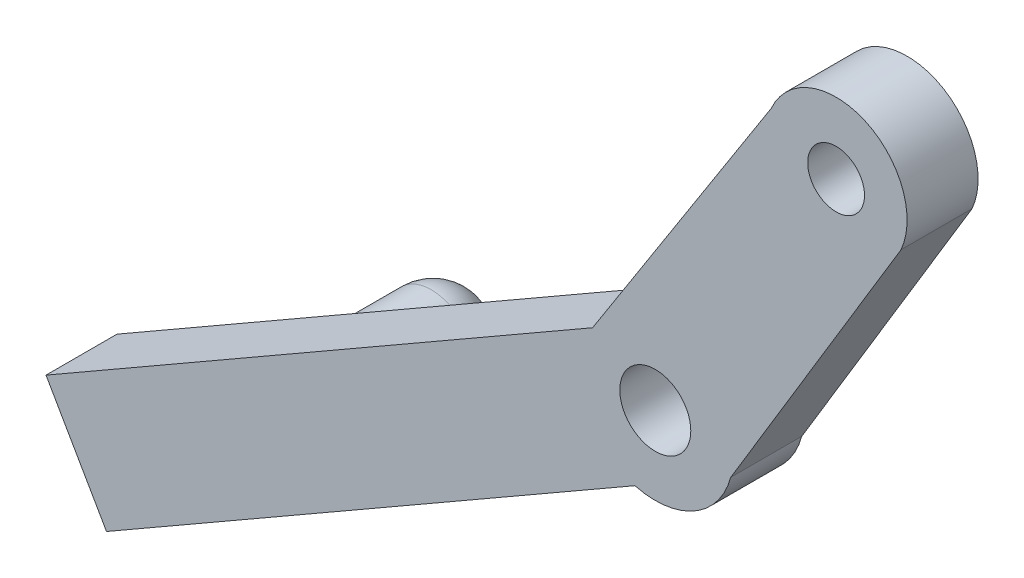
from build123d import *

# Parameters (mm, degrees)
SKETCH1_R           = 2
SKETCH1_R_2         = 2.5
BOSS_EXTRUDE1_DEPTH = 5
SKETCH8_R           = 3
BOSS_EXTRUDE3_DEPTH = 10


with BuildPart() as part:
    # Sketch1 → Boss-Extrude1 (new body)
    with BuildSketch(Plane(origin=(0, 0, 0), x_dir=(0.4985289035363021, -0.866873077410351, 0), z_dir=(0, 0, 1))):
        with BuildLine():
            ThreePointArc((8.899126574, -3.909046337), (10.510039278, -0.019959041), (8.899126574, 3.869128256))
            Line((8.899126574, 3.869128256), (-2.35642803, 24.179978159))
            ThreePointArc((-2.35642803, 24.179978159), (-9.345167797, 25.255857552), (-10.421047189, 18.267117784))
            Line((-10.421047189, 18.267117784), (0.353553391, -2.434608777))
            Line((0.353553391, -2.434608777), (0.353553391, -46.838046337))
            Line((0.353553391, -46.838046337), (8.899126574, -46.838046337))
            Line((8.899126574, -46.838046337), (8.899126574, -3.909046337))
        make_face()
        with Locations((-6.38873761, 21.223547972)):
            Circle(SKETCH1_R, mode=Mode.SUBTRACT)
        with Locations((5.010039278, -0.019959041)):
            Circle(SKETCH1_R_2, mode=Mode.SUBTRACT)
    extrude(amount=BOSS_EXTRUDE1_DEPTH)

    # Sketch8 → Boss-Extrude3 (add)
    with BuildSketch(Plane(origin=(0, 0, 0), x_dir=(-1, 0, 0), z_dir=(0, 0, -1))):
        with Locations((25.293181008, -19.882635909)):
            Circle(SKETCH8_R)
    extrude(amount=BOSS_EXTRUDE3_DEPTH)

    # Sketch9 → Cut-Revolve1 (revolve, cut)
    with BuildSketch(Plane(origin=(2.306364199, -4.010449578, 0), x_dir=(-0.8668730774103511, -0.498528903536302, 0), z_dir=(0.498528903536302, -0.8668730774103511, 0))):
        with BuildLine():
            Line((32.838046337, 10), (34.838046337, 10))
            Line((34.838046337, 10), (34.838046337, 7))
            ThreePointArc((34.838046337, 7), (34.292209794, 8.802775638), (32.838046337, 10))
        make_face()
    revolve(axis=Axis((-25.293181008, -19.882635909, -10), (0, 0, 1)), mode=Mode.SUBTRACT)


solid = part.part
